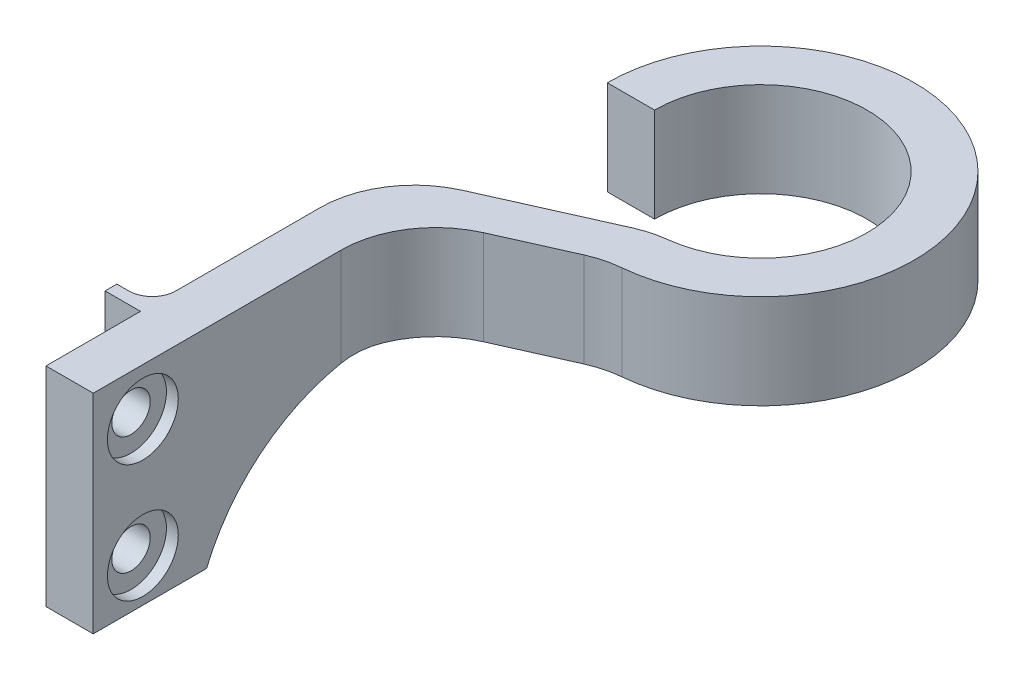
from build123d import *

# Parameters (mm, degrees)
BOSS_EXTRUDE1_DEPTH = 8
BOSS_EXTRUDE2_DEPTH = 4
FILLET1_R           = 8
SKETCH3_R           = 1.625
CUT_EXTRUDE1_DEPTH  = 52.963032648
SKETCH4_R           = 3
CUT_EXTRUDE2_DEPTH  = 1
SKETCH5_W           = 1
SKETCH5_H           = 17.649761518
BOSS_EXTRUDE3_DEPTH = 3
FILLET2_R           = 2


with BuildPart() as part:
    # Sketch1 → Boss-Extrude1 (new body)
    with BuildSketch(Plane(origin=(0, 0, 0), x_dir=(1, 0, 0), z_dir=(0, 1, 0))):
        with BuildLine():
            Line((-16, -16.133170244), (-16, -44.520095044))
            Line((-16, -44.520095044), (-12, -44.520095044))
            Line((-12, -44.520095044), (-12, -18.349877683))
            Line((-12, -18.349877683), (0, -13))
            ThreePointArc((0, -13), (9.192388155, 9.192388155), (-13, 0))
            Line((-13, 0), (-9, 0))
            ThreePointArc((-9, 0), (6.363961031, 6.363961031), (0, -9))
            Line((0, -9), (-16, -16.133170244))
        make_face()
    extrude(amount=BOSS_EXTRUDE1_DEPTH)

    # Sketch2 → Boss-Extrude2 (add)
    with BuildSketch(Plane.ZY.offset(16)):
        with BuildLine():
            Line((44.520095044, 0), (44.520095044, -9.649761518))
            Line((44.520095044, -9.649761518), (34.926950901, -9.649761518))
            ThreePointArc((34.926950901, -9.649761518), (29.19009206, -2.635329296), (20.520095044, 0))
            Line((20.520095044, 0), (44.520095044, 0))
        make_face()
    extrude(amount=-BOSS_EXTRUDE2_DEPTH)

    # Fillet1
    fillet1_edges = [part.edges().sort_by_distance(p)[0] for p in [
        (0, 4, 13),
        (-12, 4, 18.349877683),
    ]]
    fillet(fillet1_edges, radius=FILLET1_R)
    fillet1_2_edges = [part.edges().sort_by_distance(p)[0] for p in [
        (0, 4, 9),
        (-16, 4, 16.133170244),
    ]]
    fillet(fillet1_2_edges, radius=FILLET1_R)

    # Sketch3 → Cut-Extrude1 (cut, through all)
    with BuildSketch(Plane(origin=(-12, 0, 0), x_dir=(0, 0, -1), z_dir=(1, 0, 0))):
        with Locations((-40.320095044, 4)):
            Circle(SKETCH3_R)
        with Locations((-40.320095044, -6)):
            Circle(SKETCH3_R)
    extrude(amount=-CUT_EXTRUDE1_DEPTH, mode=Mode.SUBTRACT)

    # Sketch4 → Cut-Extrude2 (cut)
    with BuildSketch(Plane(origin=(-12, 0, 0), x_dir=(0, 0, -1), z_dir=(1, 0, 0))):
        with Locations((-40.320095044, 4)):
            Circle(SKETCH4_R)
        with Locations((-40.320095044, -6)):
            Circle(SKETCH4_R)
    extrude(amount=-CUT_EXTRUDE2_DEPTH, mode=Mode.SUBTRACT)

    # Sketch5 → Boss-Extrude3 (add)
    with BuildSketch(Plane.ZY.offset(16)):
        with Locations((36.020095044, -0.824880759)):
            Rectangle(SKETCH5_W, SKETCH5_H)
    extrude(amount=BOSS_EXTRUDE3_DEPTH)

    # Fillet2
    fillet2_edges = [part.edges().sort_by_distance(p)[0] for p in [
        (-16, -0.824880759, 35.520095044),
    ]]
    fillet(fillet2_edges, radius=FILLET2_R)


solid = part.part
